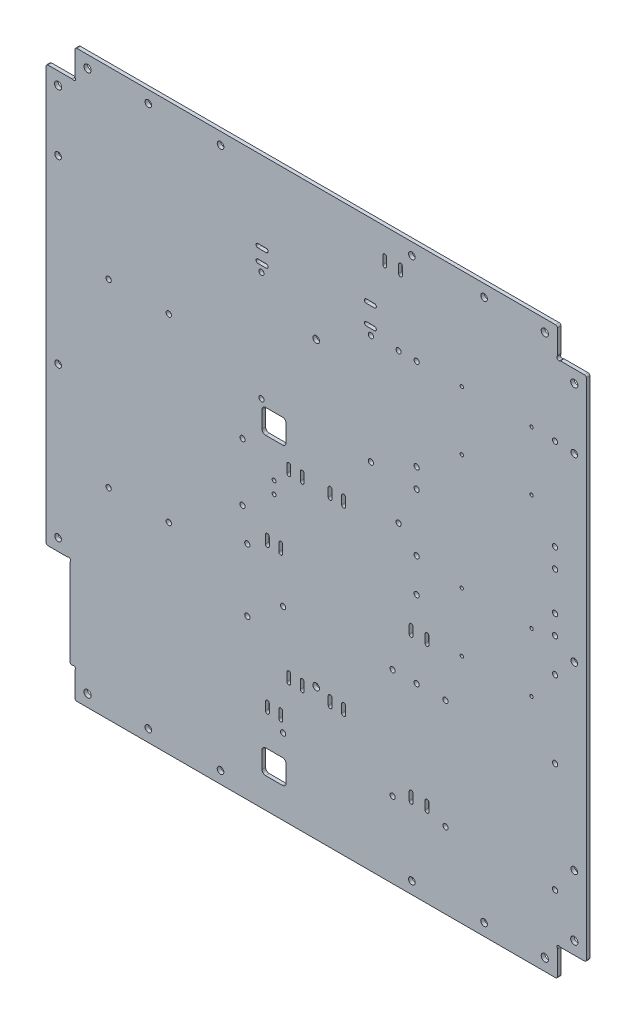
from build123d import *

# Parameters (mm, degrees)
SKETCH2_W                                      = 449
SKETCH2_H                                      = 470
BOSS_EXTRUDE1_DEPTH                            = 3
M5_CLEARANCE_HOLE1_D                           = 5.5
SKETCH7_R                                      = 2.15
DUET2_MOUNTING_HOLES_DEPTH                     = 651.007692262
SKETCH9_R                                      = 2.2
PSU_MOUNTING_HOLES_DEPTH                       = 651.007692262
SKETCH11_R                                     = 2.15
SSR_HOLES_DEPTH                                = 651.007692262
SKETCH27_R                                     = 2.15
F_5V_DC_DC_CONVERTER_FOR_RASPI_DEPTH           = 651.007692262
SKETCH18_R                                     = 2.15
DUET3_MINI_AND_EXPANDERS_DEPTH                 = 651.007692262
SKETCH25_R                                     = 1.35
RASPI_OPTIONS_DEPTH                            = 651.007692262
SKETCH26_R                                     = 2.15
DUET3_MINI_AND_3HC_DEPTH                       = 651.007692262
SKETCH12_R                                     = 3
INSIDE_CORNER_BRACKET_SCREW_CLEARANCE_HO_DEPTH = 651.007692262
SKETCH6_W                                      = 3.175
SKETCH6_H                                      = 10
SKETCH6_W_2                                    = 10
SKETCH6_H_2                                    = 3.175
MAIN_WIRING_TIE_DOWNS_DEPTH                    = 651.007692262
SKETCH13_W                                     = 24
SKETCH13_H                                     = 24
CUT_EXTRUDE1_DEPTH                             = 651.007692262
FILLET4_R                                      = 1.5875
SKETCH19_W                                     = 20
SKETCH19_H                                     = 100
POWER_INLET_SOCKET_CUTOUT_DEPTH                = 651.007692262
SKETCH20_W                                     = 20
SKETCH20_H                                     = 20
SKETCH20_W_2                                   = 3.175
SKETCH20_H_2                                   = 10
BED_HEATER_HOLES_DEPTH                         = 651.007692262
FILLET6_R                                      = 3
SKETCH22_R                                     = 1.6
CABLE_CHAIN_ATTACHMENT_POINTS_DEPTH            = 651.007692262
FILLET7_R                                      = 1.5875
SKETCH24_R                                     = 1.5875
SKETCH24_R_2                                   = 1.59
CUT_EXTRUDE6_DEPTH                             = 651.007692262
FILLET8_R                                      = 1


with BuildPart() as part:
    # Sketch2 → Boss-Extrude1 (new body)
    with BuildSketch(Plane.XY):
        with Locations((224.5, 235)):
            Rectangle(SKETCH2_W, SKETCH2_H)
    extrude(amount=BOSS_EXTRUDE1_DEPTH)

    # M5 Clearance Hole1 (through all)
    with Locations(Plane(origin=(0, 0, 0), x_dir=(-1, 0, 0), z_dir=(0, 0, -1))):
        with Locations((-10, 235), (-224.5, 360), (-224.5, 110), (-364, 460), (-85, 460), (-304, 460), (-145, 460), (-85, 10), (-145, 10), (-304, 10), (-364, 10), (-439, 385), (-439, 85), (-10, 110), (-10, 385), (-439, 235)):
            Hole(M5_CLEARANCE_HOLE1_D / 2)

    # Sketch7 → Duet2 mounting holes (cut, through all)
    with BuildSketch(Plane(origin=(0, 0, 0), x_dir=(-1, 0, 0), z_dir=(0, 0, -1))):
        with Locations((-423, 386)):
            Circle(SKETCH7_R)
        with Locations((-308, 386)):
            Circle(SKETCH7_R)
        with Locations((-308, 294)):
            Circle(SKETCH7_R)
        with Locations((-423, 294)):
            Circle(SKETCH7_R)
        with Locations((-423, 246)):
            Circle(SKETCH7_R)
        with Locations((-308, 246)):
            Circle(SKETCH7_R)
        with Locations((-308, 154)):
            Circle(SKETCH7_R)
        with Locations((-423, 154)):
            Circle(SKETCH7_R)
    extrude(amount=-DUET2_MOUNTING_HOLES_DEPTH, mode=Mode.SUBTRACT)

    # Sketch9 → psu mounting holes (cut, through all)
    with BuildSketch(Plane(origin=(0, 0, 0), x_dir=(-1, 0, 0), z_dir=(0, 0, -1))):
        with Locations((-52, 317)):
            Circle(SKETCH9_R)
        with Locations((-102, 317)):
            Circle(SKETCH9_R)
        with Locations((-52, 167)):
            Circle(SKETCH9_R)
        with Locations((-102, 167)):
            Circle(SKETCH9_R)
    extrude(amount=-PSU_MOUNTING_HOLES_DEPTH, mode=Mode.SUBTRACT)

    # Sketch11 → ssr holes (cut, through all)
    with BuildSketch(Plane(origin=(0, 0, 0), x_dir=(-1, 0, 0), z_dir=(0, 0, -1))):
        with Locations((-163.25, 258)):
            Circle(SKETCH11_R)
        with Locations((-163.25, 210)):
            Circle(SKETCH11_R)
    extrude(amount=-SSR_HOLES_DEPTH, mode=Mode.SUBTRACT)

    # Sketch27 → 5V DC/DC Converter for Raspi (cut, through all)
    with BuildSketch(Plane(origin=(0, 0, 0), x_dir=(-1, 0, 0), z_dir=(0, 0, -1))):
        with Locations((-167.25, 184.15)):
            Circle(SKETCH27_R)
        with Locations((-167.25, 132.15)):
            Circle(SKETCH27_R)
    extrude(amount=-F_5V_DC_DC_CONVERTER_FOR_RASPI_DEPTH, mode=Mode.SUBTRACT)

    # Sketch18 → Duet3, Mini, and Expanders (cut, through all)
    with BuildSketch(Plane(origin=(0, 0, 0), x_dir=(-1, 0, 0), z_dir=(0, 0, -1))):
        with Locations((-293, 386)):
            Circle(SKETCH18_R)
        with Locations((-293, 262)):
            Circle(SKETCH18_R)
        with Locations((-332, 154)):
            Circle(SKETCH18_R)
        with Locations((-332, 63)):
            Circle(SKETCH18_R)
        with Locations((-423, 63)):
            Circle(SKETCH18_R)
        with Locations((-288, 154)):
            Circle(SKETCH18_R)
        with Locations((-288, 63)):
            Circle(SKETCH18_R)
        with Locations((-197, 63)):
            Circle(SKETCH18_R)
        with Locations((-197, 154)):
            Circle(SKETCH18_R)
        with Locations((-423, 262)):
            Circle(SKETCH18_R)
    extrude(amount=-DUET3_MINI_AND_EXPANDERS_DEPTH, mode=Mode.SUBTRACT)

    # Sketch25 → Raspi Options (cut, through all)
    with BuildSketch(Plane(origin=(0, 0, 0), x_dir=(-1, 0, 0), z_dir=(0, 0, -1))):
        with Locations((-403.5, 386.5)):
            Circle(SKETCH25_R)
        with Locations((-345.5, 386.5)):
            Circle(SKETCH25_R)
        with Locations((-345.5, 337.5)):
            Circle(SKETCH25_R)
        with Locations((-403.5, 337.5)):
            Circle(SKETCH25_R)
        with Locations((-403.5, 241.5)):
            Circle(SKETCH25_R)
        with Locations((-345.5, 241.5)):
            Circle(SKETCH25_R)
        with Locations((-345.5, 192.5)):
            Circle(SKETCH25_R)
        with Locations((-403.5, 192.5)):
            Circle(SKETCH25_R)
    extrude(amount=-RASPI_OPTIONS_DEPTH, mode=Mode.SUBTRACT)

    # Sketch26 → Duet3 Mini and 3HC (cut, through all)
    with BuildSketch(Plane(origin=(0, 0, 0), x_dir=(-1, 0, 0), z_dir=(0, 0, -1))):
        with Locations((-179, 385.5)):
            Circle(SKETCH26_R)
        with Locations((-270, 385.5)):
            Circle(SKETCH26_R)
        with Locations((-179, 294.5)):
            Circle(SKETCH26_R)
        with Locations((-270, 294.5)):
            Circle(SKETCH26_R)
        with Locations((-423, 310)):
            Circle(SKETCH26_R)
        with Locations((-308, 310)):
            Circle(SKETCH26_R)
        with Locations((-308, 218)):
            Circle(SKETCH26_R)
        with Locations((-423, 218)):
            Circle(SKETCH26_R)
    extrude(amount=-DUET3_MINI_AND_3HC_DEPTH, mode=Mode.SUBTRACT)

    # Sketch12 → inside corner bracket screw clearance ho (cut, through all)
    with BuildSketch(Plane(origin=(0, 0, 0), x_dir=(-1, 0, 0), z_dir=(0, 0, -1))):
        with Locations((-414.5, 460)):
            Circle(SKETCH12_R)
        with Locations((-34.5, 460)):
            Circle(SKETCH12_R)
        with Locations((-439, 435.5)):
            Circle(SKETCH12_R)
        with Locations((-439, 34.5)):
            Circle(SKETCH12_R)
        with Locations((-414.5, 10)):
            Circle(SKETCH12_R)
        with Locations((-34.5, 10)):
            Circle(SKETCH12_R)
        with Locations((-10, 34.5)):
            Circle(SKETCH12_R)
        with Locations((-10, 435.5)):
            Circle(SKETCH12_R)
    extrude(amount=-INSIDE_CORNER_BRACKET_SCREW_CLEARANCE_HO_DEPTH, mode=Mode.SUBTRACT)

    # Sketch6 → main wiring tie-downs (cut, through all)
    with BuildSketch(Plane(origin=(0, 0, 0), x_dir=(-1, 0, 0), z_dir=(0, 0, -1))):
        with Locations((-247.2625, 255)):
            Rectangle(SKETCH6_W, SKETCH6_H)
        with Locations((-236.0875, 255)):
            Rectangle(SKETCH6_W, SKETCH6_H)
        with Locations((-247.2625, 105)):
            Rectangle(SKETCH6_W, SKETCH6_H)
        with Locations((-236.0875, 105)):
            Rectangle(SKETCH6_W, SKETCH6_H)
        with Locations((-179.5, 403.2375)):
            Rectangle(SKETCH6_W_2, SKETCH6_H_2)
        with Locations((-269.5, 392.0625)):
            Rectangle(SKETCH6_W_2, SKETCH6_H_2)
        with Locations((-269.5, 408.4125)):
            Rectangle(SKETCH6_W_2, SKETCH6_H_2)
        with Locations((-179.5, 392.0625)):
            Rectangle(SKETCH6_W_2, SKETCH6_H_2)
        with Locations((-212.9125, 105)):
            Rectangle(SKETCH6_W, SKETCH6_H)
        with Locations((-201.7375, 105)):
            Rectangle(SKETCH6_W, SKETCH6_H)
        with Locations((-316.5875, 70)):
            Rectangle(SKETCH6_W, SKETCH6_H)
        with Locations((-303.4125, 70)):
            Rectangle(SKETCH6_W, SKETCH6_H)
        with Locations((-316.5875, 190)):
            Rectangle(SKETCH6_W, SKETCH6_H)
        with Locations((-303.4125, 190)):
            Rectangle(SKETCH6_W, SKETCH6_H)
        with Locations((-294.5875, 445)):
            Rectangle(SKETCH6_W, SKETCH6_H)
        with Locations((-281.4125, 445)):
            Rectangle(SKETCH6_W, SKETCH6_H)
        with Locations((-212.9125, 255)):
            Rectangle(SKETCH6_W, SKETCH6_H)
        with Locations((-201.7375, 255)):
            Rectangle(SKETCH6_W, SKETCH6_H)
    extrude(amount=-MAIN_WIRING_TIE_DOWNS_DEPTH, mode=Mode.SUBTRACT)

    # Sketch13 → Cut-Extrude1 (cut, through all)
    with BuildSketch(Plane(origin=(0, 0, 0), x_dir=(-1, 0, 0), z_dir=(0, 0, -1))):
        with Locations((-437, 12)):
            Rectangle(SKETCH13_W, SKETCH13_H)
        with Locations((-12, 12)):
            Rectangle(SKETCH13_W, SKETCH13_H)
        with Locations((-437, 458)):
            Rectangle(SKETCH13_W, SKETCH13_H)
        with Locations((-12, 458)):
            Rectangle(SKETCH13_W, SKETCH13_H)
    extrude(amount=-CUT_EXTRUDE1_DEPTH, mode=Mode.SUBTRACT)

    # Fillet4
    fillet4_edges = [part.edges().sort_by_distance(p)[0] for p in [
        (234.5, 250, 1.5),
        (245.675, 250, 1.5),
        (248.85, 250, 1.5),
        (237.675, 250, 1.5),
        (237.675, 260, 1.5),
        (248.85, 260, 1.5),
        (245.675, 260, 1.5),
        (234.5, 260, 1.5),
        (264.5, 393.65, 1.5),
        (264.5, 410, 1.5),
        (274.5, 406.825, 1.5),
        (274.5, 390.475, 1.5),
        (274.5, 393.65, 1.5),
        (274.5, 410, 1.5),
        (264.5, 390.475, 1.5),
        (264.5, 406.825, 1.5),
        (174.5, 390.475, 1.5),
        (174.5, 393.65, 1.5),
        (184.5, 393.65, 1.5),
        (184.5, 390.475, 1.5),
        (184.5, 401.65, 1.5),
        (174.5, 401.65, 1.5),
        (174.5, 404.825, 1.5),
        (184.5, 404.825, 1.5),
        (245.675, 100, 1.5),
        (248.85, 100, 1.5),
        (248.85, 110, 1.5),
        (245.675, 110, 1.5),
        (237.675, 100, 1.5),
        (234.5, 100, 1.5),
        (237.675, 110, 1.5),
        (234.5, 110, 1.5),
        (318.175, 75, 1.5),
        (315, 75, 1.5),
        (305, 75, 1.5),
        (301.825, 75, 1.5),
        (318.175, 65, 1.5),
        (315, 65, 1.5),
        (305, 65, 1.5),
        (301.825, 65, 1.5),
        (301.825, 185, 1.5),
        (315, 185, 1.5),
        (318.175, 185, 1.5),
        (305, 185, 1.5),
        (315, 195, 1.5),
        (318.175, 195, 1.5),
        (305, 195, 1.5),
        (301.825, 195, 1.5),
        (296.175, 440, 1.5),
        (283, 440, 1.5),
        (279.825, 440, 1.5),
        (293, 440, 1.5),
        (293, 450, 1.5),
        (296.175, 450, 1.5),
        (283, 450, 1.5),
        (279.825, 450, 1.5),
        (203.325, 100, 1.5),
        (214.5, 100, 1.5),
        (211.325, 110, 1.5),
        (200.15, 110, 1.5),
        (214.5, 110, 1.5),
        (203.325, 110, 1.5),
        (211.325, 100, 1.5),
        (200.15, 100, 1.5),
        (200.15, 250, 1.5),
        (211.325, 250, 1.5),
        (203.325, 250, 1.5),
        (214.5, 250, 1.5),
        (211.325, 260, 1.5),
        (214.5, 260, 1.5),
        (203.325, 260, 1.5),
        (200.15, 260, 1.5),
    ]]
    fillet(fillet4_edges, radius=FILLET4_R - 0.0001)  # a hair under: the kernel refuses the full size

    # Sketch19 → power inlet socket cutout (cut, through all)
    with BuildSketch(Plane(origin=(0, 0, 0), x_dir=(-1, 0, 0), z_dir=(0, 0, -1))):
        with Locations((-10, 50)):
            Rectangle(SKETCH19_W, SKETCH19_H)
    extrude(amount=-POWER_INLET_SOCKET_CUTOUT_DEPTH, mode=Mode.SUBTRACT)

    # Sketch20 → Bed Heater Holes (cut, through all)
    with BuildSketch(Plane(origin=(0, 0, 0), x_dir=(-1, 0, 0), z_dir=(0, 0, -1))):
        with Locations((-189.5, 280)):
            Rectangle(SKETCH20_W, SKETCH20_H)
        with Locations((-183.9125, 195)):
            Rectangle(SKETCH20_W_2, SKETCH20_H_2)
        with Locations((-195.0875, 195)):
            Rectangle(SKETCH20_W_2, SKETCH20_H_2)
        with Locations((-183.9125, 75)):
            Rectangle(SKETCH20_W_2, SKETCH20_H_2)
        with Locations((-195.0875, 75)):
            Rectangle(SKETCH20_W_2, SKETCH20_H_2)
        with Locations((-189.5, 35)):
            Rectangle(SKETCH20_W, SKETCH20_H)
    extrude(amount=-BED_HEATER_HOLES_DEPTH, mode=Mode.SUBTRACT)

    # Fillet6
    fillet6_edges = [part.edges().sort_by_distance(p)[0] for p in [
        (179.5, 290, 1.5),
        (179.5, 270, 1.5),
        (199.5, 270, 1.5),
        (199.5, 290, 1.5),
        (179.5, 45, 1.5),
        (179.5, 25, 1.5),
        (199.5, 25, 1.5),
        (199.5, 45, 1.5),
    ]]
    fillet(fillet6_edges, radius=FILLET6_R)

    # Sketch22 → Cable Chain Attachment Points (cut, through all)
    with BuildSketch(Plane(origin=(0, 0, 0), x_dir=(-1, 0, 0), z_dir=(0, 0, -1))):
        with Locations((-189.5, 241)):
            Circle(SKETCH22_R)
        with Locations((-189.5, 231)):
            Circle(SKETCH22_R)
    extrude(amount=-CABLE_CHAIN_ATTACHMENT_POINTS_DEPTH, mode=Mode.SUBTRACT)

    # Fillet7
    fillet7_edges = [part.edges().sort_by_distance(p)[0] for p in [
        (449, 24, 1.5),
        (425, 0, 1.5),
        (24, 0, 1.5),
        (20, 24, 1.5),
        (0, 100, 1.5),
        (0, 446, 1.5),
        (24, 470, 1.5),
        (449, 446, 1.5),
        (425, 470, 1.5),
        (193.5, 190, 1.5),
        (182.325, 190, 1.5),
        (196.675, 200, 1.5),
        (185.5, 200, 1.5),
        (182.325, 200, 1.5),
        (193.5, 200, 1.5),
        (185.5, 190, 1.5),
        (196.675, 190, 1.5),
        (185.5, 70, 1.5),
        (196.675, 70, 1.5),
        (182.325, 70, 1.5),
        (193.5, 70, 1.5),
        (182.325, 80, 1.5),
        (193.5, 80, 1.5),
        (185.5, 80, 1.5),
        (196.675, 80, 1.5),
    ]]
    fillet(fillet7_edges, radius=FILLET7_R - 0.0001)  # a hair under: the kernel refuses the full size

    # Sketch24 → Cut-Extrude6 (cut, through all)
    with BuildSketch(Plane(origin=(0, 0, 0), x_dir=(-1, 0, 0), z_dir=(0, 0, -1))):
        with Locations((-18.877467985, 98.877467985)):
            Circle(SKETCH24_R)
        with Locations((-22.875700218, 447.124299782)):
            Circle(SKETCH24_R_2)
        with Locations((-426.124299782, 447.124299782)):
            Circle(SKETCH24_R_2)
        with Locations((-426.124299782, 22.875700218)):
            Circle(SKETCH24_R_2)
        with Locations((-22.875700218, 22.875700218)):
            Circle(SKETCH24_R_2)
    extrude(amount=-CUT_EXTRUDE6_DEPTH, mode=Mode.SUBTRACT)

    # Fillet8
    fillet8_edges = [part.edges().sort_by_distance(p)[0] for p in [
        (20, 97.75493597, 1.5),
        (17.75493597, 100, 1.5),
        (427.248599564, 446, 1.5),
        (425, 448.248599564, 1.5),
        (21.751400436, 446, 1.5),
        (24, 448.248599564, 1.5),
        (427.248599564, 24, 1.5),
        (425, 21.751400436, 1.5),
        (24, 21.751400436, 1.5),
        (21.751400436, 24, 1.5),
    ]]
    fillet(fillet8_edges, radius=FILLET8_R)


solid = part.part
